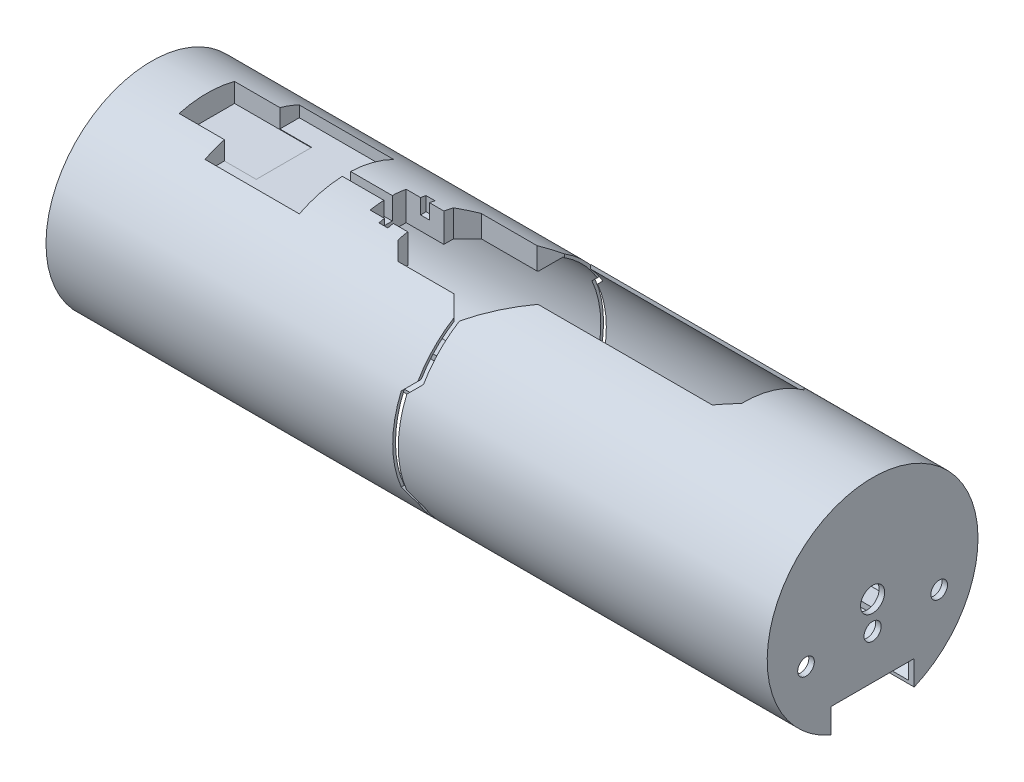
from build123d import *

# Parameters (mm, degrees)
SKETCH1_R                   = 49.53
CAN_BODY_DEPTH              = 330.2
SEPARATION_DEPTH            = 304.8
SEPARATION_DEPTH_BACK       = 304.8
SHELL1_START                = -327.66
SHELL1_OUTLINE_R            = 46.99
SHELL1_DEPTH                = 161.29
SHELL2_START                = -168.91
SHELL2_OUTLINE_R            = 46.99
SHELL2_DEPTH                = 166.37
SKETCH3_R                   = 3.81
SKETCH3_R_2                 = 3.937
CORD_AND_ROD_CUTS_DEPTH     = 344.424
BOTTOM_RETENTION_RAIL_DEPTH = 140.97
POWER_SWITCH_SLOT_DEPTH     = 35.56
TOP_RETENTION_RIDGE_DEPTH   = 140.97
SKETCH9_R                   = 5.5245
CENTER_HOLE_DEPTH           = 368.3
TOP_GUIDE_RAIL_DEPTH        = 163.83
BOTTOM_START                = -166.37
BOTTOM_GUIDE_RAIL_DEPTH     = 163.576
GOPRO_SLOT_DEPTH            = 2.54
GOPRO_SLOT_DEPTH_BACK       = 96.012
GOPRO_SLOT_START            = -68.58
SKETCH14_W                  = 42.037
SKETCH14_H                  = 58.42
SKETCH13_W                  = 132.445406608
SKETCH13_H                  = 121.677106584
SKETCH13_R                  = 48.26
TOLERANCE_ADJUST_DEPTH      = 343.662
GOPRO_SLOT_CORNERS_DEPTH    = 96.012
SKETCH18_W                  = 16.51
SKETCH18_H                  = 25.4
RUNCAM_CAMERA_CUTOUT_DEPTH  = 17.272
SKETCH19_W                  = 4.064
SKETCH19_H                  = 2.54
CUT_EXTRUDE1_DEPTH          = 7.62
CUT_EXTRUDE2_DEPTH          = 10.16
SKETCH21_W                  = 35.306
SKETCH21_H                  = 25.4
CUT_EXTRUDE3_DEPTH          = 10.414


# Read off the part's stored shape, not the designer's step: Shell1, Shell2
with BuildPart() as part:
    # Sketch1 → Can Body (new body)
    with BuildSketch(Plane(origin=(0, 0, 0), x_dir=(0, 0, -1), z_dir=(1, 0, 0))):
        Circle(SKETCH1_R)
    extrude(amount=-CAN_BODY_DEPTH)

    # Sketch2 → Separation (cut, two sides: drawn at the far end of the back side and taken through both)
    with BuildSketch(Plane.XY.offset(-SEPARATION_DEPTH_BACK)):
        Polygon((-168.91, 19.05), (-168.91, -19.05), (-163.83, -24.13), (-163.83, -49.53), (-166.37, -49.53), (-166.37, -24.13), (-171.45, -19.05), (-171.45, 19.05), (-166.37, 24.13), (-166.37, 49.53), (-163.83, 49.53), (-163.83, 24.13), align=None)
    extrude(amount=SEPARATION_DEPTH + SEPARATION_DEPTH_BACK, mode=Mode.SUBTRACT)


with BuildPart() as separation_piece_1:
    # of the separate pieces the step leaves, piece 1, a body of its own (separation_pieces)
    add(part.part.solids().sort_by_distance((0, 0, -49.53))[0])

    # Shell2 outline → Shell2 (cut)
    with BuildSketch(Plane.YZ.offset(SHELL2_START)):
        Circle(SHELL2_OUTLINE_R)
    extrude(amount=SHELL2_DEPTH, mode=Mode.SUBTRACT)


with BuildPart() as separation_piece_2:
    # of the separate pieces the step leaves, piece 2, a body of its own (separation_pieces)
    add(part.part.solids().sort_by_distance((-171.45, 0, -49.53))[0])

    # Shell1 outline → Shell1 (cut)
    with BuildSketch(Plane.YZ.offset(SHELL1_START)):
        Circle(SHELL1_OUTLINE_R)
    extrude(amount=SHELL1_DEPTH, mode=Mode.SUBTRACT)


with BuildPart() as cord_and_rod_cuts_tool:
    # Sketch3 → Cord and rod cuts (new body)
    with BuildSketch(Plane(origin=(0, 0, 0), x_dir=(0, 0, -1), z_dir=(1, 0, 0))):
        with Locations((-30.48, -11.43)):
            Circle(SKETCH3_R)
        with Locations((30.48, -11.43)):
            Circle(SKETCH3_R)
        with Locations((0, -12.7)):
            Circle(SKETCH3_R_2)
        Polygon((19.05, -33.02), (-19.05, -33.02), (-19.05, -45.72), (-19.05, -57.214809543), (19.05, -57.214809543), (19.05, -45.72), align=None)
    extrude(amount=-CORD_AND_ROD_CUTS_DEPTH)


with BuildPart() as separation_piece_1_1:
    add(separation_piece_1.part)

    # Cord and rod cuts: cut by cord_and_rod_cuts_tool
    add(cord_and_rod_cuts_tool.part, mode=Mode.SUBTRACT)

    # Sketch7 → Top Retention Ridge (add)
    with BuildSketch(Plane.ZY.offset(163.83)):
        with BuildLine():
            Line((19.428741027, 34.29), (-19.428741027, 34.29))
            Line((-19.428741027, 34.29), (-24.954796178, 39.81605515))
            ThreePointArc((-24.954796178, 39.81605515), (0, 46.99), (24.954796178, 39.81605515))
            Line((24.954796178, 39.81605515), (19.428741027, 34.29))
        make_face()
    extrude(amount=-TOP_RETENTION_RIDGE_DEPTH)


with BuildPart() as separation_piece_2_1:
    add(separation_piece_2.part)

    # Cord and rod cuts: cut by cord_and_rod_cuts_tool
    add(cord_and_rod_cuts_tool.part, mode=Mode.SUBTRACT)

    # Sketch4 → Bottom Retention Rail (add)
    with BuildSketch(Plane(origin=(-166.37, 0, 0), x_dir=(0, 0, -1), z_dir=(1, 0, 0))):
        with BuildLine():
            Line((-7.62, 34.29), (-19.428741027, 34.29))
            Line((-19.428741027, 34.29), (-24.954796178, 39.81605515))
            ThreePointArc((-24.954796178, 39.81605515), (0, 46.99), (24.954796178, 39.81605515))
            Line((24.954796178, 39.81605515), (19.428741027, 34.29))
            Line((19.428741027, 34.29), (7.62, 34.29))
            Line((7.62, 34.29), (-7.62, 34.29))
        make_face()
    extrude(amount=-BOTTOM_RETENTION_RAIL_DEPTH)

    # Sketch5 → Power Switch Slot (cut)
    with BuildSketch(Plane(origin=(0, 49.53, 0), x_dir=(1, 0, 0), z_dir=(0, 1, 0))):
        Polygon((-204.557426539, 12.7), (-204.557426539, -12.7), (-198.207426539, -19.05), (-172.656179285, -19.05), (-166.37, -25.336179285), (-166.37, 25.336179285), (-172.656179285, 19.05), (-198.207426539, 19.05), align=None)
    extrude(amount=-POWER_SWITCH_SLOT_DEPTH, mode=Mode.SUBTRACT)


with BuildPart() as center_hole_tool:
    # Sketch9 → Center Hole (new body)
    with BuildSketch(Plane(origin=(0, 0, 0), x_dir=(0, 0, -1), z_dir=(1, 0, 0))):
        Circle(SKETCH9_R)
    extrude(amount=-CENTER_HOLE_DEPTH)


with BuildPart() as separation_piece_1_2:
    add(separation_piece_1_1.part)

    # Center Hole: cut by center_hole_tool
    add(center_hole_tool.part, mode=Mode.SUBTRACT)

    # Sketch10 → Top Guide Rail (add)
    with BuildSketch(Plane(origin=(0, 0, 0), x_dir=(0, 0, -1), z_dir=(1, 0, 0))):
        Polygon((-38.841242823, -30.734), (-27.411242823, -30.734), (-27.411242823, -33.274), (-36.688715213, -33.274), (-37.233551179, -31.620508339), align=None)
        Polygon((37.233551179, -31.620508339), (38.841242823, -30.734), (27.411242823, -30.734), (27.411242823, -33.274), (36.688715213, -33.274), align=None)
    extrude(amount=-TOP_GUIDE_RAIL_DEPTH)

    # Sketch14 → GoPro Slot (cut, two sides: drawn at the far end of the back side and taken through both)
    with BuildSketch(Plane(origin=(0, 0, 0), x_dir=(0, 0, -1), z_dir=(1, 0, 0)).offset(GOPRO_SLOT_START - GOPRO_SLOT_DEPTH_BACK)):
        with Locations((13.6525, 29.21)):
            Rectangle(SKETCH14_W, SKETCH14_H)
    extrude(amount=GOPRO_SLOT_DEPTH + GOPRO_SLOT_DEPTH_BACK, mode=Mode.SUBTRACT)


with BuildPart() as separation_piece_2_2:
    add(separation_piece_2_1.part)

    # Center Hole: cut by center_hole_tool
    add(center_hole_tool.part, mode=Mode.SUBTRACT)

    # Sketch10<2> → Bottom Guide Rail (add)
    with BuildSketch(Plane(origin=(0, 0, 0), x_dir=(0, 0, -1), z_dir=(1, 0, 0)).offset(BOTTOM_START)):
        Polygon((-38.841242823, -30.734), (-27.411242823, -30.734), (-27.411242823, -33.274), (-36.688715213, -33.274), (-37.233551179, -31.620508339), align=None)
        Polygon((37.233551179, -31.620508339), (38.841242823, -30.734), (27.411242823, -30.734), (27.411242823, -33.274), (36.688715213, -33.274), align=None)
    extrude(amount=-BOTTOM_GUIDE_RAIL_DEPTH)


with BuildPart() as tolerance_adjust_tool:
    # Sketch13 → Tolerance Adjust (new body)
    with BuildSketch(Plane(origin=(0, 0, 0), x_dir=(0, 0, -1), z_dir=(1, 0, 0))):
        Rectangle(SKETCH13_W, SKETCH13_H)
        Circle(SKETCH13_R, mode=Mode.SUBTRACT)
    extrude(amount=-TOLERANCE_ADJUST_DEPTH)


with BuildPart() as separation_piece_1_3:
    add(separation_piece_1_2.part)

    # Tolerance Adjust: cut by tolerance_adjust_tool
    add(tolerance_adjust_tool.part, mode=Mode.SUBTRACT)

    # Sketch15 → GoPro Slot Corners (cut)
    with BuildSketch(Plane(origin=(0, 0, 0), x_dir=(1, 0, 0), z_dir=(0, 1, 0))):
        Polygon((-66.04, 34.671), (-59.39461047, 28.02561047), (-59.39461047, -0.72061047), (-66.04, -7.366), align=None)
        Polygon((-163.83, 34.671), (-145.859820715, 34.671), (-145.859820715, -7.366), (-163.83, -25.336179285), align=None)
    extrude(amount=GOPRO_SLOT_CORNERS_DEPTH, mode=Mode.SUBTRACT)


with BuildPart() as separation_piece_2_3:
    add(separation_piece_2_2.part)

    # Tolerance Adjust: cut by tolerance_adjust_tool
    add(tolerance_adjust_tool.part, mode=Mode.SUBTRACT)

    # Sketch18 → Runcam Camera Cutout (cut)
    with BuildSketch(Plane(origin=(-204.557426539, 0, 0), x_dir=(0, 0, -1), z_dir=(1, 0, 0))):
        with Locations((0, 43.18)):
            Rectangle(SKETCH18_W, SKETCH18_H)
    extrude(amount=-RUNCAM_CAMERA_CUTOUT_DEPTH, mode=Mode.SUBTRACT)

    # Sketch19 → Cut-Extrude1 (cut)
    with BuildSketch(Plane(origin=(0, 48.26, 0), x_dir=(1, 0, 0), z_dir=(0, 1, 0))):
        with Locations((-213.193426539, 9.525)):
            Rectangle(SKETCH19_W, SKETCH19_H)
        with Locations((-213.193426539, -9.525)):
            Rectangle(SKETCH19_W, SKETCH19_H)
    extrude(amount=-CUT_EXTRUDE1_DEPTH, mode=Mode.SUBTRACT)

    # Sketch20 → Cut-Extrude2 (cut)
    with BuildSketch(Plane(origin=(0, 48.26, 0), x_dir=(1, 0, 0), z_dir=(0, 1, 0))):
        Polygon((-240.879426539, 1.905), (-240.879426539, 21.59), (-284.059426539, 21.59), (-284.059426539, -21.59), (-240.879426539, -21.59), (-240.879426539, -1.905), (-221.829426539, -1.905), (-221.829426539, 1.905), align=None)
    extrude(amount=-CUT_EXTRUDE2_DEPTH, mode=Mode.SUBTRACT)

    # Sketch21 → Cut-Extrude3 (cut)
    with BuildSketch(Plane(origin=(0, 48.26, 0), x_dir=(1, 0, 0), z_dir=(0, 1, 0))):
        with Locations((-287.147, 0)):
            Rectangle(SKETCH21_W, SKETCH21_H)
    extrude(amount=-CUT_EXTRUDE3_DEPTH, mode=Mode.SUBTRACT)


solid = Compound([separation_piece_1_3.part, separation_piece_2_3.part])
